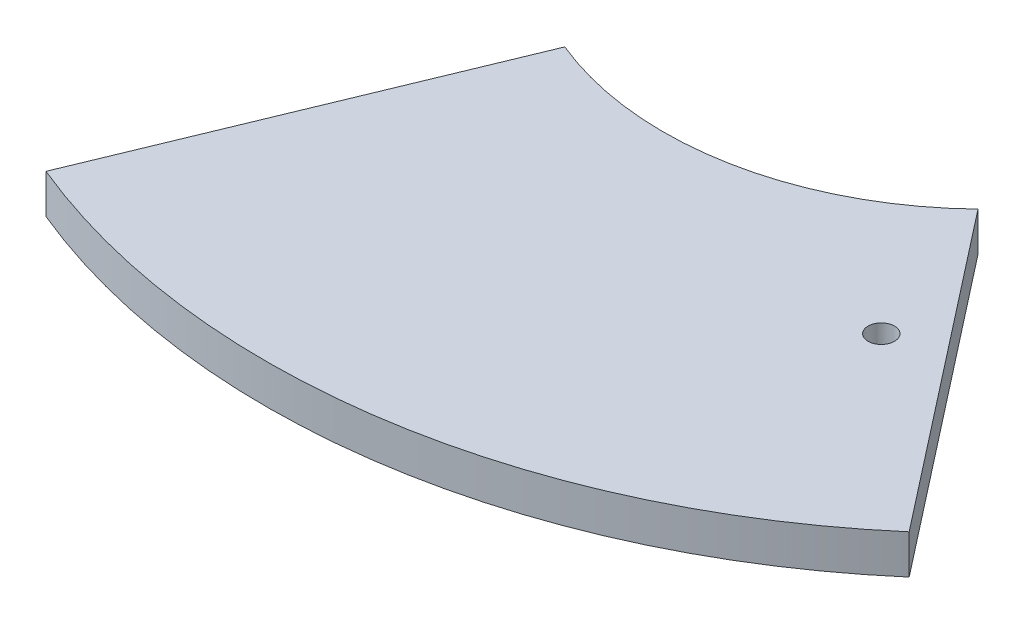
from build123d import *

# Parameters (mm, degrees)
SKETCH_1_R           = 210
EXTRUDE_1_DEPTH      = 10
SKETCH_2_R           = 75
CUT_EXTRUDE_1_DEPTH  = 10
SKETCH_4_R           = 82.197423103
CUT_EXTRUDE_3_DEPTH  = 10
SKETCH_5_R           = 232.576786868
SKETCH_5_R_2         = 183.037626036
CUT_EXTRUDE_4_DEPTH  = 10
CUT_EXTRUDE_6_DEPTH  = 10
CUT_EXTRUDE_7_DEPTH  = 10
EXTRUDE_2_DEPTH      = 10
SKETCH_8_R           = 3.37024185
CUT_EXTRUDE_9_DEPTH  = 10
EXTRUDE_START        = -10
EXTRUDE_3_DEPTH      = 10
SKETCH_10_R          = 221.118951793
SKETCH_10_R_2        = 189.34656242
CUT_EXTRUDE_10_DEPTH = 20
SKETCH_11_R          = 238.000555744
SKETCH_11_R_2        = 183.483177488
CUT_EXTRUDE_11_DEPTH = 20


with BuildPart() as part:
    # 草图1 → 凸台-拉伸1 (new body)
    with BuildSketch(Plane(origin=(0, 0, 0), x_dir=(1, 0, 0), z_dir=(0, 1, 0))):
        Circle(SKETCH_1_R)
    extrude(amount=EXTRUDE_1_DEPTH)

    # 草图2 → 切除-拉伸1 (cut)
    with BuildSketch(Plane(origin=(0, 10, 0), x_dir=(1, 0, 0), z_dir=(0, 1, 0))):
        Circle(SKETCH_2_R)
    extrude(amount=-CUT_EXTRUDE_1_DEPTH, mode=Mode.SUBTRACT)

    # 草图4 → 切除-拉伸3 (cut)
    with BuildSketch(Plane(origin=(0, 10, 0), x_dir=(1, 0, 0), z_dir=(0, 1, 0))):
        Circle(SKETCH_4_R)
    extrude(amount=-CUT_EXTRUDE_3_DEPTH, mode=Mode.SUBTRACT)

    # 草图5 → 切除-拉伸4 (cut)
    with BuildSketch(Plane(origin=(0, 10, 0), x_dir=(1, 0, 0), z_dir=(0, 1, 0))):
        Circle(SKETCH_5_R)
        Circle(SKETCH_5_R_2, mode=Mode.SUBTRACT)
    extrude(amount=-CUT_EXTRUDE_4_DEPTH, mode=Mode.SUBTRACT)

    # 草图3 → 切除-拉伸6 (cut)
    with BuildSketch(Plane(origin=(0, 10, 0), x_dir=(1, 0, 0), z_dir=(0, 1, 0))):
        Polygon((-218.107078413, -133.413550562), (-168.78547064, -202.149571439), (-50, -50), (50, -50), (168.78547064, -202.149571439), (64.609548257, -313.747882065), (267.248585971, -202.149571439), (429.751389162, 108.172046702), (-16.641853339, 302.979624022), (-278.723850855, 176.468454352), align=None)
    extrude(amount=-CUT_EXTRUDE_6_DEPTH, mode=Mode.SUBTRACT)

    # 草图6 → 切除-拉伸7 (cut)
    with BuildSketch(Plane(origin=(0, 10, 0), x_dir=(1, 0, 0), z_dir=(0, 1, 0))):
        Polygon((0, 0), (0, -233.405297089), (-177.211837764, -160.795172893), (-110.712466595, -38.220656306), align=None)
    extrude(amount=-CUT_EXTRUDE_7_DEPTH, mode=Mode.SUBTRACT)

    # 草图7 → 凸台-拉伸2 (add)
    with BuildSketch(Plane(origin=(0, 10, 0), x_dir=(1, 0, 0), z_dir=(0, 1, 0))):
        with BuildLine():
            Line((0, -131.161321566), (0, -190))
            ThreePointArc((0, -190), (65.897168622, -178.206518308), (123.6137367, -144.290138606))
            Line((123.6137367, -144.290138606), (94.010463478, -106.371988266))
            Line((94.010463478, -106.371988266), (0, -131.161321566))
        make_face()
    extrude(amount=-EXTRUDE_2_DEPTH)

    # 草图8 → 切除-拉伸9 (cut)
    with BuildSketch(Plane(origin=(0, 10, 0), x_dir=(1, 0, 0), z_dir=(0, 1, 0))):
        with Locations((72.297266291, -98.948546348)):
            Circle(SKETCH_8_R)
    extrude(amount=-CUT_EXTRUDE_9_DEPTH, mode=Mode.SUBTRACT)

    # 草图9 → 凸台-拉伸3 (add)
    with BuildSketch(Plane.XZ.offset(EXTRUDE_START)):
        with BuildLine():
            Line((-72.52965516, 175.611642901), (-31.37763554, 75.972760596))
            ThreePointArc((-31.37763554, 75.972760596), (-15.994549348, 80.626241112), (0, 82.197423103))
            Line((0, 82.197423103), (0, 190))
            ThreePointArc((0, 190), (-36.971528565, 186.36820028), (-72.52965516, 175.611642901))
        make_face()
    extrude(amount=EXTRUDE_3_DEPTH)

    # 草图10 → 切除-拉伸10 (cut)
    with BuildSketch(Plane.XZ):
        with Locations((6.928171241, 3.379528268)):
            Circle(SKETCH_10_R)
        Circle(SKETCH_10_R_2, mode=Mode.SUBTRACT)
    extrude(amount=-CUT_EXTRUDE_10_DEPTH, mode=Mode.SUBTRACT)

    # 草图11 → 切除-拉伸11 (cut)
    with BuildSketch(Plane.XZ):
        with Locations((0, 17.732727097)):
            Circle(SKETCH_11_R)
        Circle(SKETCH_11_R_2, mode=Mode.SUBTRACT)
    extrude(amount=-CUT_EXTRUDE_11_DEPTH, mode=Mode.SUBTRACT)


solid = part.part
